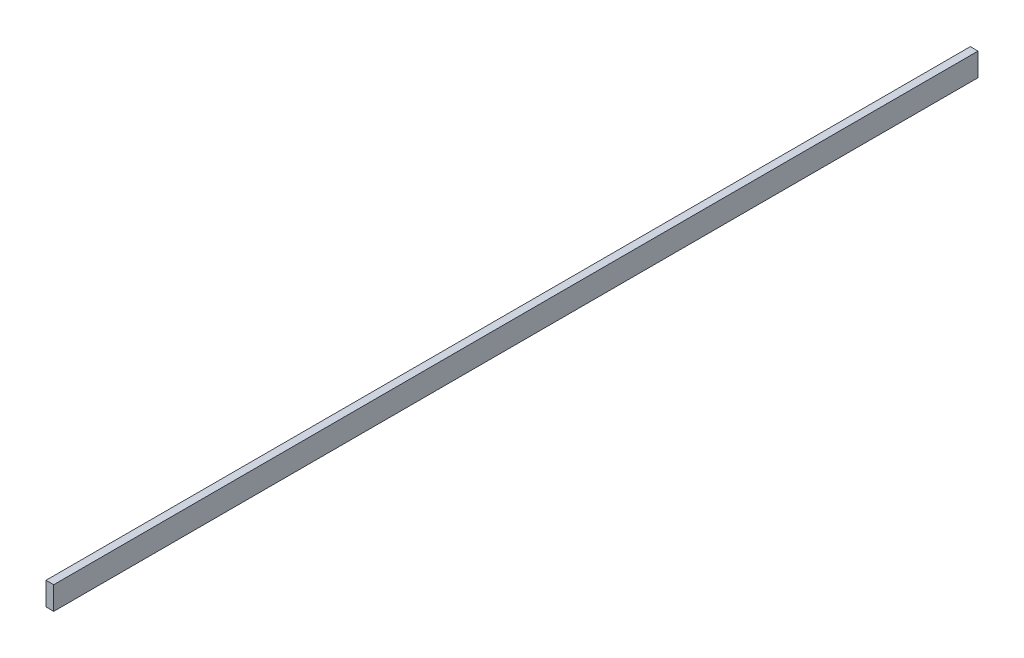
from build123d import *

# Parameters (mm, degrees)
ESQUISSE1_W        = 50
ESQUISSE1_H        = 150
BOSS_EXTRU_1_DEPTH = 6000


with BuildPart() as part:
    # Esquisse1 → Boss.-Extru.1 (new body)
    with BuildSketch(Plane.XY):
        with Locations((25, 75)):
            Rectangle(ESQUISSE1_W, ESQUISSE1_H)
    extrude(amount=BOSS_EXTRU_1_DEPTH)


solid = part.part
